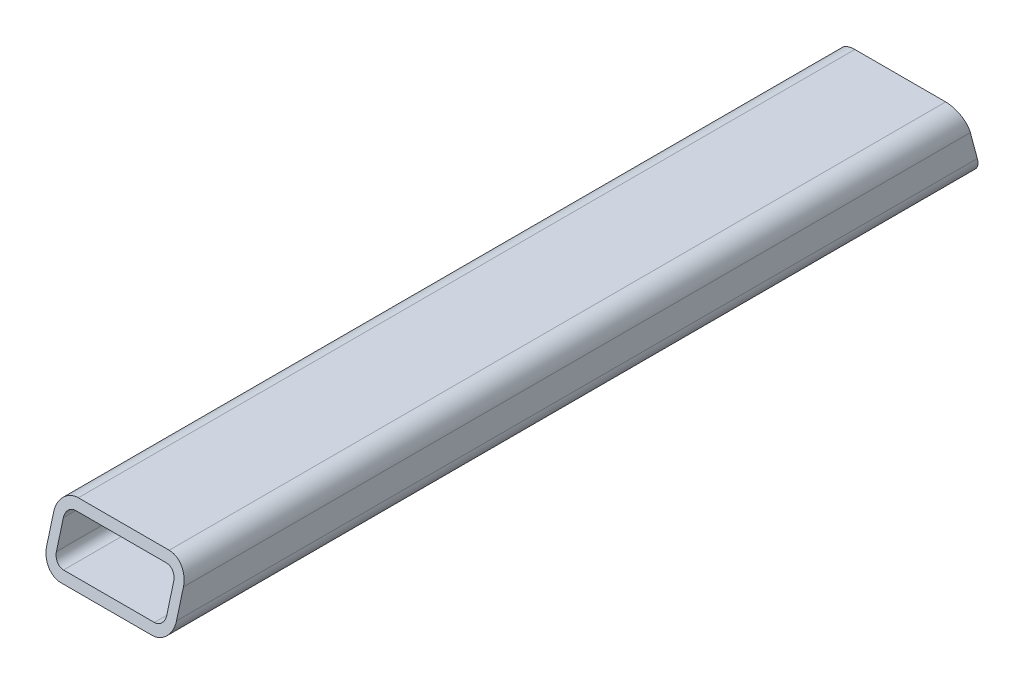
from build123d import *

# Parameters (mm, degrees)
EXTRUDE_1_DEPTH      = 125
EXTRUDE_1_DEPTH_BACK = 125
SHELL_1_T            = -3
CHAMFER_1_SIZE       = 5.358983849
CHAMFER_1_SIZE_2     = 20


with BuildPart() as part:
    # Эскиз1 → Бобышка-Вытянуть1 (new, two sides: drawn at the far end of the back side and taken through both)
    with BuildSketch(Plane.XY.offset(-EXTRUDE_1_DEPTH_BACK)):
        with BuildLine():
            Line((-14, 10), (14, 10))
            ThreePointArc((14, 10), (18.242640687, 8.242640687), (20, 4))
            Line((20, 4), (20, -4))
            ThreePointArc((20, -4), (18.242640687, -8.242640687), (14, -10))
            Line((14, -10), (-14, -10))
            ThreePointArc((-14, -10), (-18.242640687, -8.242640687), (-20, -4))
            Line((-20, -4), (-20, 4))
            ThreePointArc((-20, 4), (-18.242640687, 8.242640687), (-14, 10))
        make_face()
    extrude(amount=EXTRUDE_1_DEPTH + EXTRUDE_1_DEPTH_BACK)

    # Оболочка1
    shell_1_openings = [part.faces().sort_by_distance(p)[0] for p in [
        (0, 0, -125),
        (0, 0, 125),
    ]]
    offset(amount=SHELL_1_T, openings=shell_1_openings, kind=Kind.INTERSECTION)

    # Фаска1
    # the kernel refuses this chamfer: 20, 5.358983849 mm, written as the material it takes off along each edge
    with BuildSketch(Plane(origin=(-65.934431404, 10, -125), x_dir=(0, 0.13751244702128945, 0.9905000388259543), z_dir=(1, 0, 0))) as chamfer_1_piece_1:
        Polygon((CHAMFER_1_SIZE * 0.990500038756, CHAMFER_1_SIZE * 0.137512447012), (-CHAMFER_1_SIZE_2 * 0.137512447021, CHAMFER_1_SIZE_2 * 0.990500038826), (0, 0), align=None)
    extrude(amount=131.868862808, mode=Mode.SUBTRACT)
    with BuildSketch(Plane(origin=(-65.934431404, 10, 125), x_dir=(0, 0.13751244702128945, -0.9905000388259543), z_dir=(1, 0, 0))) as chamfer_1_piece_2:
        Polygon((CHAMFER_1_SIZE * 0.990500038756, -CHAMFER_1_SIZE * 0.137512447012), (-CHAMFER_1_SIZE_2 * 0.137512447021, -CHAMFER_1_SIZE_2 * 0.990500038826), (0, 0), align=None)
    extrude(amount=131.868862808, mode=Mode.SUBTRACT)


solid = part.part
